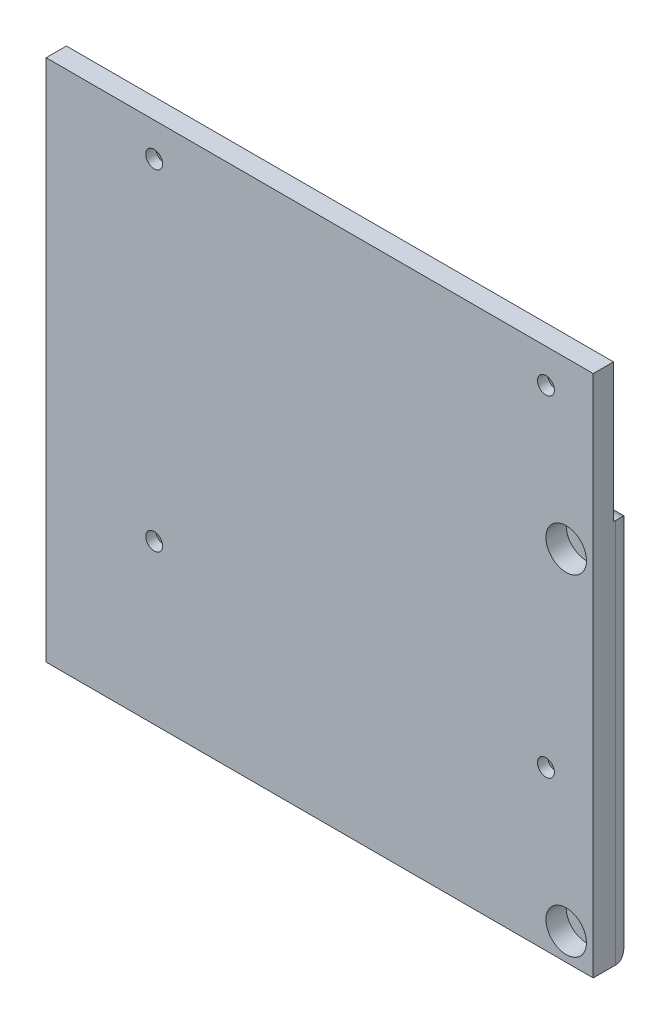
from build123d import *

# Parameters (mm, degrees)
SKETCH1_W           = 81
SKETCH1_H           = 57
SKETCH1_R           = 1.25
BOSS_EXTRUDE1_DEPTH = 3.3
SKETCH2_W           = 81
SKETCH2_H           = 77.5
SKETCH2_R           = 1.25
BOSS_EXTRUDE2_DEPTH = 3
CUT_EXTRUDE1_DEPTH  = 218.210667029
SKETCH4_R           = 6
CUT_EXTRUDE2_DEPTH  = 3.3
CUT_EXTRUDE3_DEPTH  = 1.5
SKETCH6_R           = 3
CUT_EXTRUDE4_DEPTH  = 3
FILLET1_R           = 3


with BuildPart() as part:
    # Sketch1 → Boss-Extrude1 (new body)
    with BuildSketch(Plane.XY):
        with Locations((156.100114143, 43.136740717)):
            Rectangle(SKETCH1_W, SKETCH1_H)
        with Locations((192.600114143, 18.636740717)):
            Circle(SKETCH1_R, mode=Mode.SUBTRACT)
        with Locations((192.600114143, 67.636740717)):
            Circle(SKETCH1_R, mode=Mode.SUBTRACT)
    extrude(amount=BOSS_EXTRUDE1_DEPTH)

    # Sketch2 → Boss-Extrude2 (add)
    with BuildSketch(Plane.XY.offset(3.3)):
        with Locations((156.100114143, 53.386740717)):
            Rectangle(SKETCH2_W, SKETCH2_H)
        with Locations((192.600114143, 67.636740717)):
            Circle(SKETCH2_R, mode=Mode.SUBTRACT)
        with Locations((192.600114143, 18.636740717)):
            Circle(SKETCH2_R, mode=Mode.SUBTRACT)
    extrude(amount=BOSS_EXTRUDE2_DEPTH)

    # Sketch3 → Cut-Extrude1 (cut, through all)
    with BuildSketch(Plane.XY.offset(6.3)):
        with BuildLine():
            Line((131.600114143, 85.886740717), (131.600114143, 87.136740717))
            Line((131.600114143, 87.136740717), (132.850114143, 87.136740717))
            ThreePointArc((132.850114143, 87.136740717), (130.716230667, 88.020624193), (131.600114143, 85.886740717))
        make_face()
        with BuildLine():
            Line((132.850114143, 87.136740717), (131.600114143, 87.136740717))
            Line((131.600114143, 87.136740717), (131.600114143, 85.886740717))
            ThreePointArc((131.600114143, 85.886740717), (132.48399762, 86.25285724), (132.850114143, 87.136740717))
        make_face()
        with BuildLine():
            ThreePointArc((190.850114143, 87.136740717), (189.600114143, 88.386740717), (188.350114143, 87.136740717))
            Line((188.350114143, 87.136740717), (189.600114143, 87.136740717))
            Line((189.600114143, 87.136740717), (189.600114143, 85.886740717))
            ThreePointArc((189.600114143, 85.886740717), (190.48399762, 86.25285724), (190.850114143, 87.136740717))
        make_face()
        with BuildLine():
            Line((189.600114143, 87.136740717), (188.350114143, 87.136740717))
            ThreePointArc((188.350114143, 87.136740717), (188.716230667, 86.25285724), (189.600114143, 85.886740717))
            Line((189.600114143, 85.886740717), (189.600114143, 87.136740717))
        make_face()
        with BuildLine():
            ThreePointArc((190.850114143, 38.136740717), (190.48399762, 39.020624193), (189.600114143, 39.386740717))
            Line((189.600114143, 39.386740717), (189.600114143, 38.136740717))
            Line((189.600114143, 38.136740717), (188.350114143, 38.136740717))
            ThreePointArc((188.350114143, 38.136740717), (189.600114143, 36.886740717), (190.850114143, 38.136740717))
        make_face()
        with BuildLine():
            Line((189.600114143, 38.136740717), (189.600114143, 39.386740717))
            ThreePointArc((189.600114143, 39.386740717), (188.716230667, 39.020624193), (188.350114143, 38.136740717))
            Line((188.350114143, 38.136740717), (189.600114143, 38.136740717))
        make_face()
        with BuildLine():
            ThreePointArc((132.850114143, 38.136740717), (132.48399762, 39.020624193), (131.600114143, 39.386740717))
            Line((131.600114143, 39.386740717), (131.600114143, 38.136740717))
            Line((131.600114143, 38.136740717), (132.850114143, 38.136740717))
        make_face()
        with BuildLine():
            Line((131.600114143, 38.136740717), (131.600114143, 39.386740717))
            ThreePointArc((131.600114143, 39.386740717), (130.716230667, 37.25285724), (132.850114143, 38.136740717))
            Line((132.850114143, 38.136740717), (131.600114143, 38.136740717))
        make_face()
    extrude(amount=-CUT_EXTRUDE1_DEPTH, mode=Mode.SUBTRACT)

    # Sketch4 → Cut-Extrude2 (cut)
    with BuildSketch(Plane(origin=(0, 0, 0), x_dir=(-1, 0, 0), z_dir=(0, 0, -1))):
        with Locations((-189.600114143, 38.136740717)):
            Circle(SKETCH4_R)
        with Locations((-131.600114143, 38.136740717)):
            Circle(SKETCH4_R)
    extrude(amount=-CUT_EXTRUDE2_DEPTH, mode=Mode.SUBTRACT)

    # Sketch5 → Cut-Extrude3 (cut)
    with BuildSketch(Plane(origin=(0, 0, 3.3), x_dir=(-1, 0, 0), z_dir=(0, 0, -1))):
        Polygon((-187.290713067, 87.136740717), (-188.445413605, 89.136740717), (-190.754814682, 89.136740717), (-191.90951522, 87.136740717), (-190.754814682, 85.136740717), (-188.445413605, 85.136740717), align=None)
        Polygon((-129.290713067, 87.136740717), (-130.445413605, 89.136740717), (-132.754814682, 89.136740717), (-133.90951522, 87.136740717), (-132.754814682, 85.136740717), (-130.445413605, 85.136740717), align=None)
        Polygon((-130.445413605, 40.136740717), (-132.754814682, 40.136740717), (-133.90951522, 38.136740717), (-132.754814682, 36.136740717), (-130.445413605, 36.136740717), (-129.290713067, 38.136740717), align=None)
        Polygon((-187.290713067, 38.136740717), (-188.445413605, 40.136740717), (-190.754814682, 40.136740717), (-191.90951522, 38.136740717), (-190.754814682, 36.136740717), (-188.445413605, 36.136740717), align=None)
    extrude(amount=-CUT_EXTRUDE3_DEPTH, mode=Mode.SUBTRACT)

    # Sketch6 → Cut-Extrude4 (cut)
    with BuildSketch(Plane.XY.offset(6.3)):
        with Locations((192.600114143, 67.636740717)):
            Circle(SKETCH6_R)
        with Locations((192.600114143, 18.636740717)):
            Circle(SKETCH6_R)
    extrude(amount=-CUT_EXTRUDE4_DEPTH, mode=Mode.SUBTRACT)

    # Fillet1
    # the kernel refuses this fillet: 3 mm, written as the material it takes off along each edge
    with BuildSketch(Plane(origin=(108.100114143, 71.636740717, 0), x_dir=(0, 0, 1), z_dir=(1, 0, 0))) as fillet1_piece_1:
        with BuildLine():
            CenterArc((FILLET1_R, FILLET1_R), FILLET1_R, 180, 90)
            Line((0, FILLET1_R), (0, 0))
            Line((0, 0), (FILLET1_R, 0))
        make_face()
    extrude(amount=96, mode=Mode.SUBTRACT)
    with BuildSketch(Plane(origin=(196.600114143, 79.136740717, 0), x_dir=(0, 0, 1), z_dir=(0, -1, 0)), Plane(origin=(115.600114143, 7.136740717, 0), x_dir=(0, 0, 1), z_dir=(0, 1, 0))) as fillet1_piece_2:
        with BuildLine():
            CenterArc((FILLET1_R, FILLET1_R), FILLET1_R, 180, 90)
            Line((0, FILLET1_R), (0, 0))
            Line((0, 0), (FILLET1_R, 0))
        make_face()
    extrude(amount=72, mode=Mode.SUBTRACT)
    with BuildSketch(Plane(origin=(204.100114143, 14.636740717, 0), x_dir=(0, 1, 0), z_dir=(-1, 0, 0))) as fillet1_piece_3:
        with BuildLine():
            CenterArc((FILLET1_R, -FILLET1_R), FILLET1_R, 90, 90)
            Line((0, -FILLET1_R), (0, 0))
            Line((0, 0), (FILLET1_R, 0))
        make_face()
    extrude(amount=96, mode=Mode.SUBTRACT)


solid = part.part
